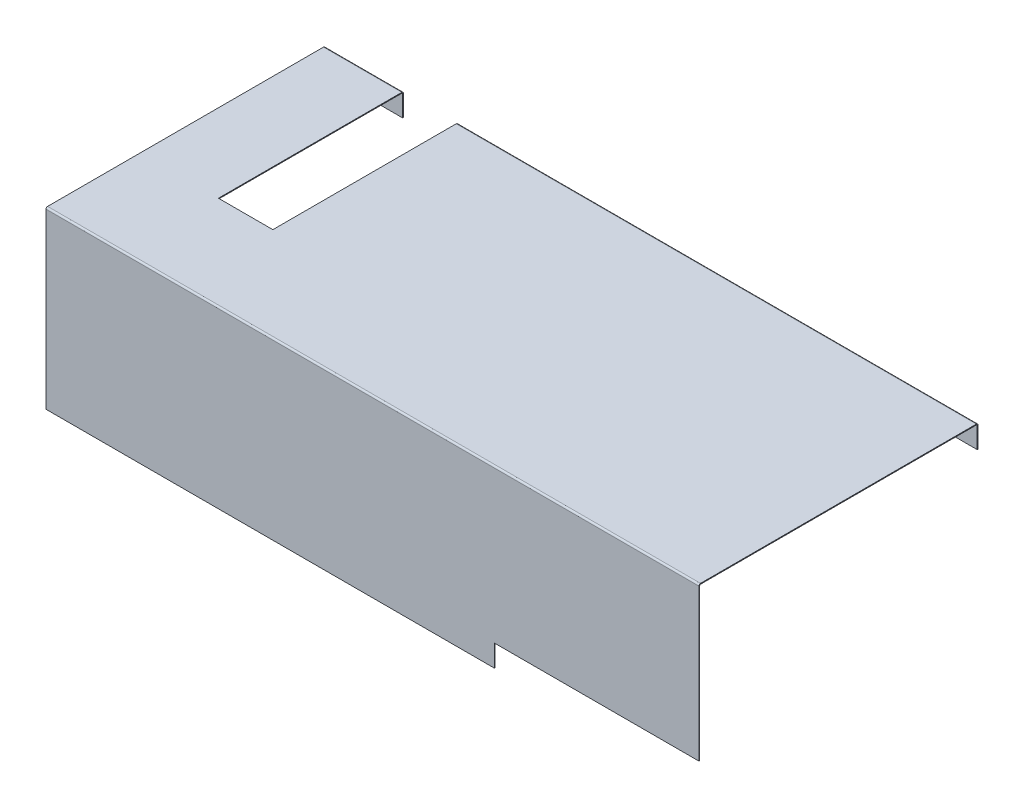
from build123d import *

# Parameters (mm, degrees)
BASE_FLANGE1_DEPTH  = 600
SKETCH7_W           = 412
SKETCH7_H           = 20
BOSS_EXTRUDE1_DEPTH = 0.7366
SKETCH8_W           = 50
SKETCH8_H           = 170
CUT_EXTRUDE2_DEPTH  = 672.742110604


# Sheet-metal steps are written as plain solids
with BuildPart() as part:
    # Sketch1 → Base-Flange1 (new body)
    with BuildSketch(Plane(origin=(0, 0, 0), x_dir=(0, 0, -1), z_dir=(1, 0, 0))):
        with BuildLine():
            Line((0, 0), (0, 139.2634))
            ThreePointArc((0, 139.2634), (0.215745145, 139.784254855), (0.7366, 140))
            Line((0.7366, 140), (254.2634, 140))
            ThreePointArc((254.2634, 140), (254.784254855, 139.784254855), (255, 139.2634))
            Line((255, 139.2634), (255, 120))
            Line((255, 120), (255.7366, 120))
            Line((255.7366, 120), (255.7366, 139.2634))
            ThreePointArc((255.7366, 139.2634), (255.30510971, 140.30510971), (254.2634, 140.7366))
            Line((254.2634, 140.7366), (0.7366, 140.7366))
            ThreePointArc((0.7366, 140.7366), (-0.30510971, 140.30510971), (-0.7366, 139.2634))
            Line((-0.7366, 139.2634), (-0.7366, 0))
            Line((-0.7366, 0), (0, 0))
        make_face()
    extrude(amount=BASE_FLANGE1_DEPTH)

    # Sketch7 → Boss-Extrude1 (add)
    with BuildSketch(Plane.XY.offset(0.7366)):
        with Locations((206, -10)):
            Rectangle(SKETCH7_W, SKETCH7_H)
    extrude(amount=-BOSS_EXTRUDE1_DEPTH)

    # Sketch8 → Cut-Extrude2 (cut, through all)
    with BuildSketch(Plane(origin=(0, 140.7366, 0), x_dir=(1, 0, 0), z_dir=(0, 1, 0))):
        with Locations((97, 170.7366)):
            Rectangle(SKETCH8_W, SKETCH8_H)
    extrude(amount=-CUT_EXTRUDE2_DEPTH, mode=Mode.SUBTRACT)


solid = part.part
